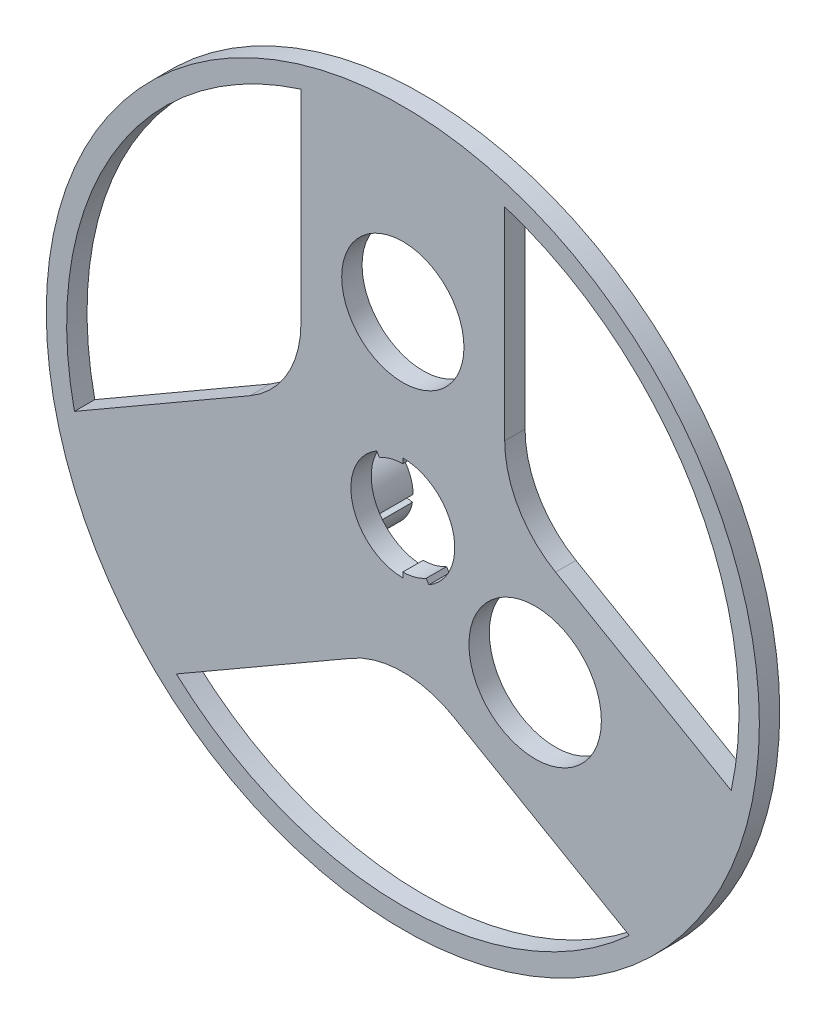
from build123d import *

# Parameters (mm, degrees)
SKETCH1_R           = 35
BOSS_EXTRUDE1_DEPTH = 2
FILLET1_R           = 10
CUT_EXTRUDE2_REACH  = 51.538
CUT_EXTRUDE3_REACH  = 51.538
SKETCH3_R           = 6
SKETCH3_R_2         = 6.5
BOSS_EXTRUDE2_DEPTH = 8


with BuildPart() as part:
    # Sketch1 → Boss-Extrude1 (new body)
    with BuildSketch(Plane.XY):
        Circle(SKETCH1_R)
        with BuildLine():
            Line((-10, 31.448370387), (-10, 5.773502692))
            Line((-10, 5.773502692), (-32.235087663, -7.063931156))
            ThreePointArc((-32.235087663, -7.063931156), (-28.578838325, 16.5), (-10, 31.448370387))
        make_face(mode=Mode.SUBTRACT)
        with BuildLine():
            Line((-22.235087663, -24.384439231), (0, -11.547005384))
            Line((0, -11.547005384), (22.235087663, -24.384439231))
            ThreePointArc((22.235087663, -24.384439231), (0, -33), (-22.235087663, -24.384439231))
        make_face(mode=Mode.SUBTRACT)
        with BuildLine():
            ThreePointArc((10, 31.448370387), (28.578838325, 16.5), (32.235087663, -7.063931156))
            Line((32.235087663, -7.063931156), (10, 5.773502692))
            Line((10, 5.773502692), (10, 31.448370387))
        make_face(mode=Mode.SUBTRACT)
    extrude(amount=BOSS_EXTRUDE1_DEPTH)

    # Fillet1
    fillet1_edges = [part.edges().sort_by_distance(p)[0] for p in [
        (10, 5.773502692, 1),
        (0, -11.547005384, 1),
        (-10, 5.773502692, 1),
    ]]
    fillet(fillet1_edges, radius=FILLET1_R)

    # Sketch2 → Cut-Extrude2 (cut, up to next)
    with BuildSketch(Plane(origin=(0, 0, 0), x_dir=(-1, 0, 0), z_dir=(0, 0, -1)), mode=Mode.PRIVATE) as cut_extrude2_sk1:
        with BuildLine():
            Line((0, 4.6), (0, 5.1))
            ThreePointArc((0, 5.1), (-4.926221714, 1.31997713), (-2.55, -4.416729559))
            Line((-2.55, -4.416729559), (-2.3, -3.983716857))
            ThreePointArc((-2.3, -3.983716857), (-1.190567607, -4.443258801), (0, -4.6))
            Line((0, -4.6), (0, -5.1))
            ThreePointArc((0, -5.1), (4.926221714, -1.31997713), (2.55, 4.416729559))
            Line((2.55, 4.416729559), (2.3, 3.983716857))
            ThreePointArc((2.3, 3.983716857), (1.190567607, 4.443258801), (0, 4.6))
        make_face()
    cut_extrude2_tool1 = extrude(cut_extrude2_sk1.sketch, amount=-CUT_EXTRUDE2_REACH, mode=Mode.PRIVATE) & part.part
    add(cut_extrude2_tool1.solids().sort_by_distance((0, 0, 0))[0], mode=Mode.SUBTRACT)

    # Sketch3 → Cut-Extrude3 (cut, up to next)
    with BuildSketch(Plane(origin=(0, 0, 0), x_dir=(-1, 0, 0), z_dir=(0, 0, -1)), mode=Mode.PRIVATE) as cut_extrude3_sk1:
        with Locations((0, 17.5)):
            Circle(SKETCH3_R)
    cut_extrude3_tool1 = extrude(cut_extrude3_sk1.sketch, amount=-CUT_EXTRUDE3_REACH, mode=Mode.PRIVATE) & part.part
    # Sketch3 → Cut-Extrude3 (cut, up to next)
    with BuildSketch(Plane(origin=(0, 0, 0), x_dir=(-1, 0, 0), z_dir=(0, 0, -1)), mode=Mode.PRIVATE) as cut_extrude3_sk2:
        with Locations((-12.990381057, -7.5)):
            Circle(SKETCH3_R_2)
    cut_extrude3_tool2 = extrude(cut_extrude3_sk2.sketch, amount=-CUT_EXTRUDE3_REACH, mode=Mode.PRIVATE) & part.part
    add(cut_extrude3_tool1.solids().sort_by_distance((0, 17.5, 0))[0], mode=Mode.SUBTRACT)
    add(cut_extrude3_tool2.solids().sort_by_distance((12.990381, -7.5, 0))[0], mode=Mode.SUBTRACT)

    # Sketch3<4> → Boss-Extrude2 (add)
    with BuildSketch(Plane(origin=(0, 0, 0), x_dir=(-1, 0, 0), z_dir=(0, 0, -1))):
        with BuildLine():
            Line((12.990381057, -3.5), (12.990381057, -4.1))
            ThreePointArc((12.990381057, -4.1), (15.17585893, -4.895448893), (16.338727417, -6.909596196))
            Line((16.338727417, -6.909596196), (16.929612069, -6.805407289))
            ThreePointArc((16.929612069, -6.805407289), (15.561531496, -4.435822228), (12.990381057, -3.5))
        make_face()
        with BuildLine():
            ThreePointArc((16.390381057, -7.5), (15.594932163, -9.685477873), (13.580784861, -10.84834636))
            Line((13.580784861, -10.84834636), (13.684973767, -11.439231012))
            ThreePointArc((13.684973767, -11.439231012), (16.054558829, -10.071150439), (16.990381057, -7.5))
            Line((16.990381057, -7.5), (16.390381057, -7.5))
        make_face()
        with BuildLine():
            ThreePointArc((12.990381057, -10.9), (10.804903184, -10.104551107), (9.642034697, -8.090403804))
            Line((9.642034697, -8.090403804), (9.051150045, -8.194592711))
            ThreePointArc((9.051150045, -8.194592711), (10.419230618, -10.564177772), (12.990381057, -11.5))
            Line((12.990381057, -11.5), (12.990381057, -10.9))
        make_face()
        with BuildLine():
            ThreePointArc((9.590381057, -7.5), (10.38582995, -5.314522127), (12.399977253, -4.15165364))
            Line((12.399977253, -4.15165364), (12.295788346, -3.560768988))
            ThreePointArc((12.295788346, -3.560768988), (9.926203284, -4.928849561), (8.990381057, -7.5))
            Line((8.990381057, -7.5), (9.590381057, -7.5))
        make_face()
    extrude(amount=BOSS_EXTRUDE2_DEPTH)


solid = part.part
